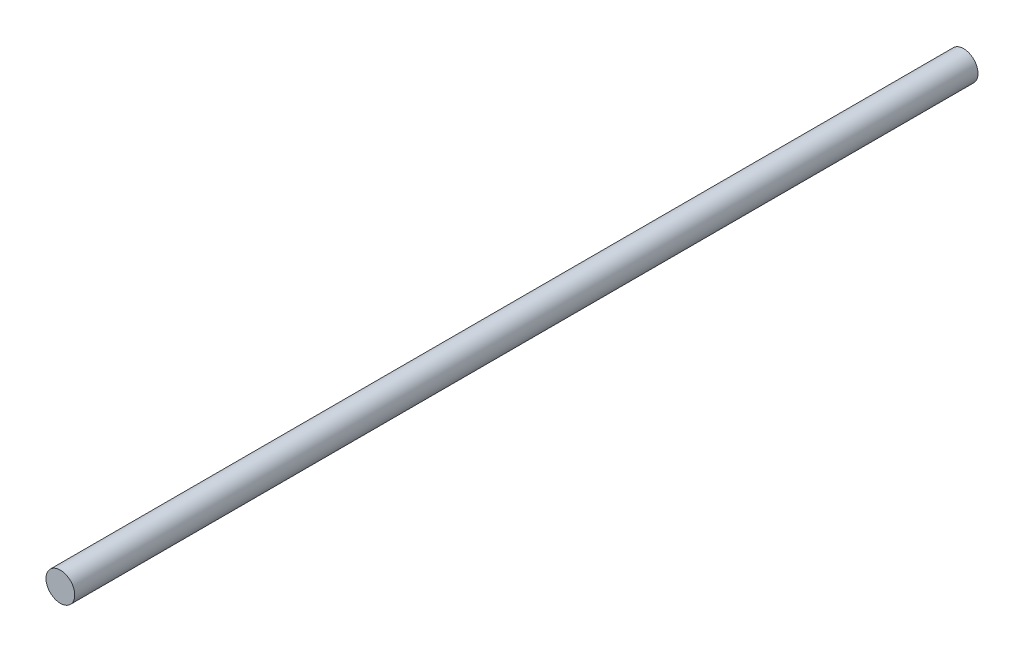
from build123d import *

# Parameters (mm, degrees)
SKETCH1_R           = 8
BOSS_EXTRUDE1_DEPTH = 251


with BuildPart() as part:
    # Sketch1 → Boss-Extrude1 (new, symmetric)
    with BuildSketch(Plane.XY):
        Circle(SKETCH1_R)
    extrude(amount=BOSS_EXTRUDE1_DEPTH, both=True)


solid = part.part
